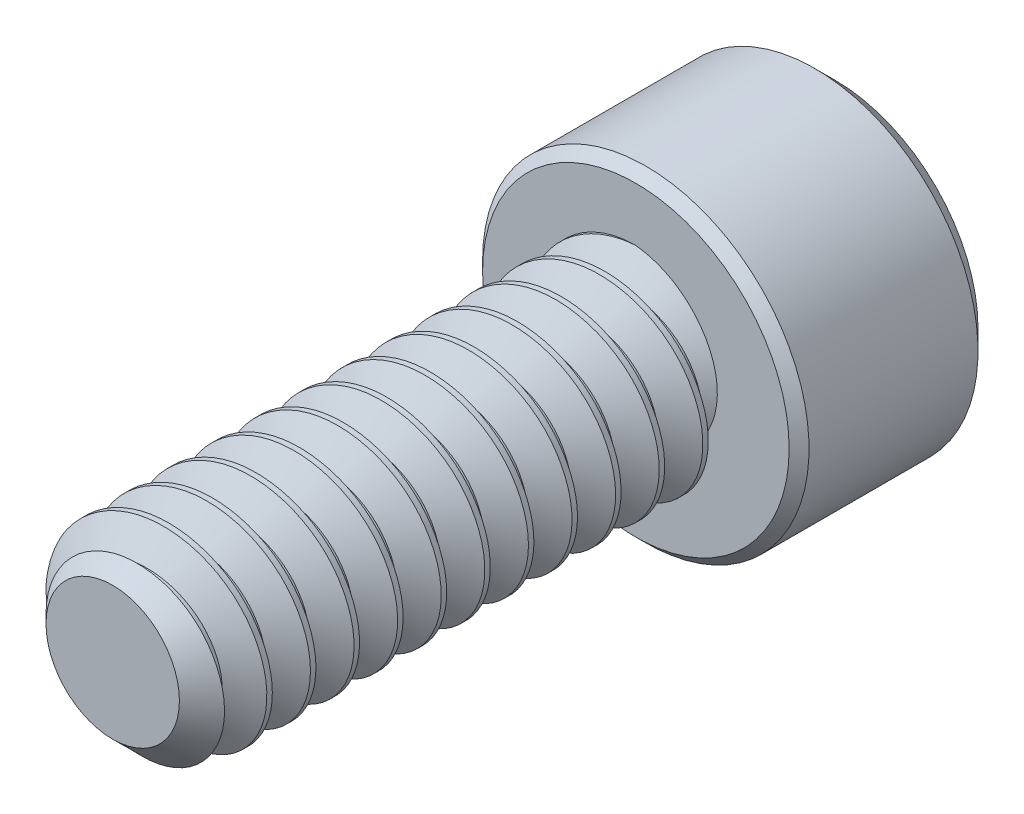
from build123d import *

# Parameters (mm, degrees)
SKETCH1_R        = 2.413
EXTRUDE1_DEPTH   = 12.7
CHAMFER3_SIZE    = 0.79375
CUT_SWEEP1_PITCH = 1.058333333
SKETCH6_R        = 3.9624
EXTRUDE2_DEPTH   = 4.826
CHAMFER1_SIZE    = 0.4826
CHAMFER2_SIZE    = 0.2413


with BuildPart() as part:
    # Sketch1 → Extrude1 (new body)
    with BuildSketch(Plane.XY):
        Circle(SKETCH1_R)
    extrude(amount=-EXTRUDE1_DEPTH)

    # Chamfer3
    chamfer3_edges = [part.edges().sort_by_distance(p)[0] for p in [
        (-2.413, 0, 0),
    ]]
    chamfer(chamfer3_edges, length=CHAMFER3_SIZE)

    # Cut-Sweep1: the profile of Sketch3 profile screwed along a right-hand helix of 13 turns, 6 arcs to a turn; built about Z, then put on its axis
    cut_sweep1_z = Axis((0, 0, 0), (0, 0, 1))
    cut_sweep1_corners = [(2.4133, 0, -0.926214872), (1.725592336, 0, -0.529166667), (1.725592336, 0, -0.396875), (2.4133, 0, 0.000173205)]
    with BuildLine(mode=Mode.PRIVATE) as cut_sweep1_profile:
        Line(cut_sweep1_corners[0], cut_sweep1_corners[1])
        Line(cut_sweep1_corners[1], cut_sweep1_corners[2])
        Line(cut_sweep1_corners[2], cut_sweep1_corners[3])
        Line(cut_sweep1_corners[3], cut_sweep1_corners[0])
    cut_sweep1_cap = Face(cut_sweep1_profile.wire())
    cut_sweep1_turn_angles = [0, 30, 60, 90, 120, 150, 180, 210, 240, 270, 300, 330, 360]
    cut_sweep1_turn_weights = [1, 0.8660254037844387, 1, 0.8660254037844387, 1, 0.8660254037844387, 1, 0.8660254037844387, 1, 0.8660254037844387, 1, 0.8660254037844387, 1]
    cut_sweep1_turn_rails = [Edge.make_bspline([Vector(p[0], p[1], 0).rotate(cut_sweep1_z, cut_sweep1_turn_angles[k]) / cut_sweep1_turn_weights[k] + Vector(0, 0, p[2] + CUT_SWEEP1_PITCH * cut_sweep1_turn_angles[k] / 360) for k in range(13)], [0, 0, 0, 1, 1, 2, 2, 3, 3, 4, 4, 5, 5, 6, 6, 6], 2, cut_sweep1_turn_weights) for p in cut_sweep1_corners]
    cut_sweep1_turn_sides = [Face.make_surface_from_curves(cut_sweep1_turn_rails[p[0]], cut_sweep1_turn_rails[p[1]]) for p in [(0, 1), (1, 2), (2, 3), (3, 0)]]
    cut_sweep1 = Plane(origin=(0, 0, 0), x_dir=(0, 1, 0), z_dir=(0, 0, -1)) * Solid(Shell([*[p.moved(Location((0, 0, CUT_SWEEP1_PITCH * i))) for i in range(13) for p in cut_sweep1_turn_sides], cut_sweep1_cap, cut_sweep1_cap.rotate(cut_sweep1_z, 4680).moved(Location((0, 0, CUT_SWEEP1_PITCH * 4680 / 360)))]))
    add(cut_sweep1, mode=Mode.SUBTRACT)

    # Sketch6 → Extrude2 (add)
    with BuildSketch(Plane(origin=(0, 0, -12.7), x_dir=(-1, 0, 0), z_dir=(0, 0, -1))):
        Circle(SKETCH6_R)
    extrude(amount=EXTRUDE2_DEPTH)

    # Chamfer1
    chamfer1_edges = [part.edges().sort_by_distance(p)[0] for p in [
        (3.9624, 0, -17.526),
    ]]
    chamfer(chamfer1_edges, length=CHAMFER1_SIZE)

    # Chamfer2
    chamfer2_edges = [part.edges().sort_by_distance(p)[0] for p in [
        (3.9624, 0, -12.7),
    ]]
    chamfer(chamfer2_edges, length=CHAMFER2_SIZE)


solid = part.part
